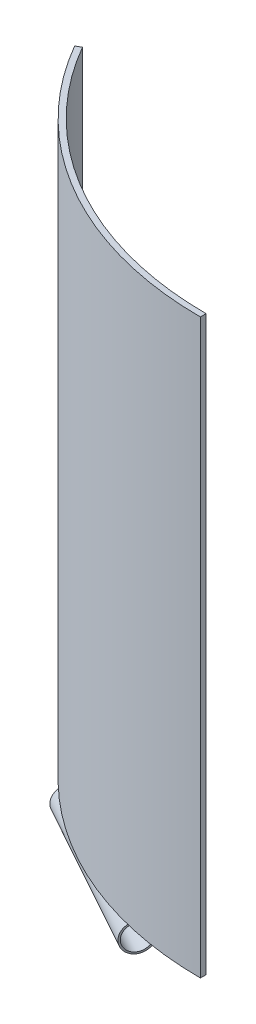
from build123d import *

# Parameters (mm, degrees)
EXTRUDE_THIN1_DEPTH      = 127
EXTRUDE_THIN2_DEPTH      = 25.4
FILLET1_R                = 19.05
BOSS_EXTRUDE3_DEPTH      = 0.762
BOSS_EXTRUDE3_DEPTH_BACK = 37.846
SKETCH11_R               = 3.175
SKETCH13_R               = 2.794
CUT_EXTRUDE1_DEPTH       = 43.18


with BuildPart() as part:
    # Sketch1 → Extrude-Thin1 (new body)
    with BuildSketch(Plane(origin=(0, 0, 0), x_dir=(1, 0, 0), z_dir=(0, 1, 0))):
        with BuildLine():
            ThreePointArc((0, -76.2), (-38.1, -65.991135768), (-65.991135768, -38.1))
            Line((-65.991135768, -38.1), (-64.891283506, -37.465))
            ThreePointArc((-64.891283506, -37.465), (-37.465, -64.891283506), (0, -74.93))
            Line((0, -74.93), (0, -76.2))
        make_face()
    extrude(amount=EXTRUDE_THIN1_DEPTH)


with BuildPart() as body_2:
    # Sketch8 → Extrude-Thin2 (new body)
    with BuildSketch(Plane(origin=(0, 0, 0), x_dir=(1, 0, 0), z_dir=(0, 1, 0))):
        with BuildLine():
            ThreePointArc((-18.060810272, -72.720781296), (-36.26692626, -65.568399093), (-52.001511157, -53.947638849))
            Line((-52.001511157, -53.947638849), (-49.357366522, -51.204538569))
            ThreePointArc((-49.357366522, -51.204538569), (-34.422845264, -62.234412699), (-17.142463987, -69.02311445))
            Line((-17.142463987, -69.02311445), (-18.060810272, -72.720781296))
        make_face()
    extrude(amount=EXTRUDE_THIN2_DEPTH)

    # Fillet1
    # the kernel refuses this fillet: 19.05 mm, written as the material it takes off along each edge
    with BuildSketch(Plane(origin=(-85.053319095, 25.4, 88.236392355), x_dir=(0, -1, 0), z_dir=(0.694001216558829, 0, -0.7199738268957181)), Plane(origin=(-5.663135424, 25.4, 22.802278881), x_dir=(0, -1, 0), z_dir=(-0.24103577034940327, 0, 0.9705162324310036))) as fillet1_piece_1:
        with BuildLine():
            CenterArc((FILLET1_R, -FILLET1_R), FILLET1_R, 90, 90)
            Line((0, -FILLET1_R), (0, 0))
            Line((0, 0), (FILLET1_R, 0))
        make_face()
    extrude(amount=99.06, mode=Mode.SUBTRACT)


with BuildPart() as body_3:
    # Sketch11 → Boss-Extrude3 (new, two sides: drawn at the far end of the back side and taken through both)
    with BuildSketch(Plane(origin=(16.107451267, 0, 8.909287941), x_dir=(0.48401076017425226, 0, -0.8750620458204906), z_dir=(0.8750620458204906, 0, 0.48401076017425226)).offset(-BOSS_EXTRUDE3_DEPTH_BACK)):
        with Locations((-71.871644766, -3.175)):
            Circle(SKETCH11_R)
    extrude(amount=BOSS_EXTRUDE3_DEPTH + BOSS_EXTRUDE3_DEPTH_BACK)

    # Sketch13 → Cut-Extrude1 (cut)
    with BuildSketch(Plane(origin=(-17.010146919, 0, -9.408583289), x_dir=(-0.48401076017425226, 0, 0.8750620458204906), z_dir=(-0.8750620458204907, 0, -0.4840107601742523))):
        with Locations((71.871644766, -3.175)):
            Circle(SKETCH13_R)
    extrude(amount=-CUT_EXTRUDE1_DEPTH, mode=Mode.SUBTRACT)


solid = Compound([part.part, body_2.part, body_3.part])
